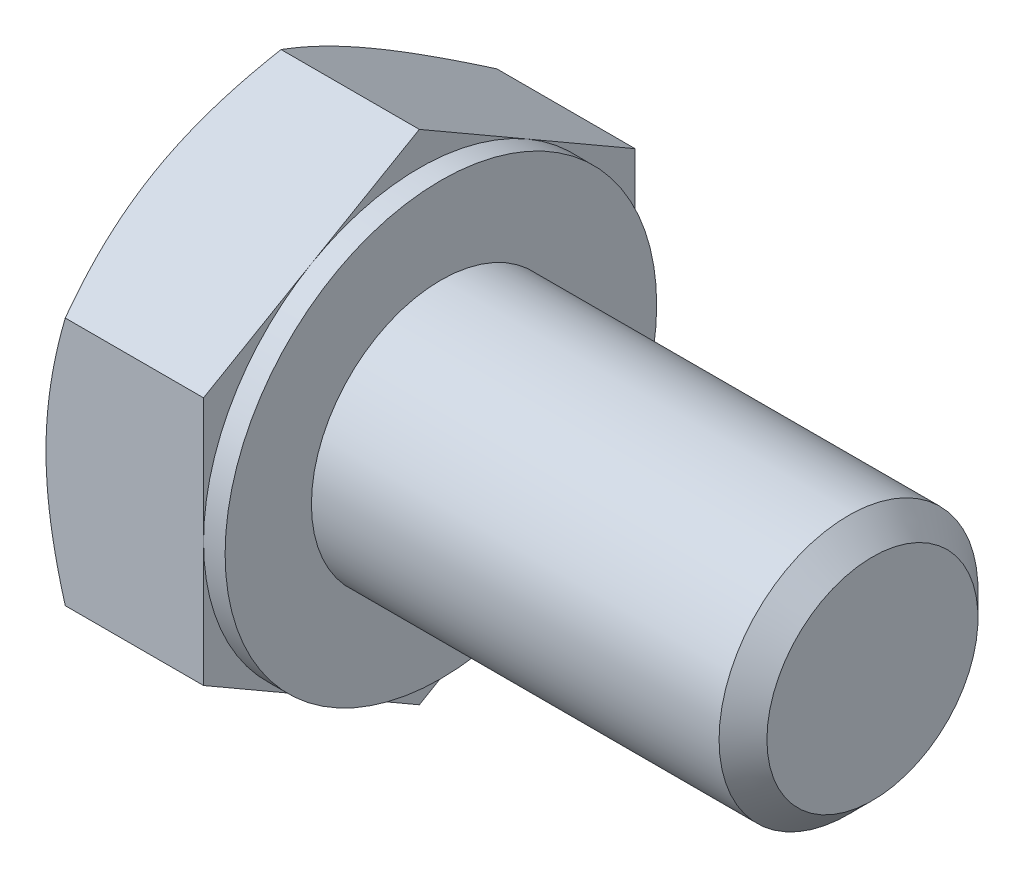
from build123d import *

# Parameters (mm, degrees)
BASEHEAD_DEPTH     = 4.15
INDENT_START       = -0.51875
INDENT_2_OUTLINE_R = 4.375
INDENT_2_DEPTH     = 0.51875
SKETCH4_W          = 0.5
SKETCH4_H          = 10.773502692


# Read off the part's stored shape, not the designer's step: Indent
with BuildPart() as part:
    # Sketch1 → BaseHead (new body)
    with BuildSketch(Plane(origin=(0, 0, 0), x_dir=(0, 0, -1), z_dir=(1, 0, 0))):
        Polygon((5, 2.886751346), (5, -2.886751346), (0, -5.773502692), (-5, -2.886751346), (-5, 2.886751346), (0, 5.773502692), align=None)
    extrude(amount=BASEHEAD_DEPTH)

    # Indent outline → Indent (revolve)
    with BuildSketch(Plane.YX):
        Polygon((3, 4.15), (3, 13.5955), (2.4455, 14.15), (0, 14.15), (0, 4.15), align=None)
    revolve(axis=Axis((0, 0, 0), (1, 0, 0)))

    # Indent 2 outline → Indent 2 (cut)
    with BuildSketch(Plane.ZY.offset(INDENT_START)):
        with Locations((0.033212245, 0.192376607)):
            Circle(INDENT_2_OUTLINE_R)
    extrude(amount=INDENT_2_DEPTH, mode=Mode.SUBTRACT)

    # Sketch3 → HeadChamfer (revolve, cut)
    with BuildSketch(Plane.XY, mode=Mode.PRIVATE) as headchamfer_sk:
        Polygon((0, 5), (3.333333333, 10.773502692), (3.333333333, 15.773502692), (-10, 15.773502692), (-10, 5), align=None)
    revolve(headchamfer_sk.sketch.rotate(Axis((0, 0, 0), (1, 0, 0)), 90), axis=Axis((0, 0, 0), (1, 0, 0)), mode=Mode.SUBTRACT)

    # Sketch4 → BearingFace (revolve, cut)
    with BuildSketch(Plane.XY, mode=Mode.PRIVATE) as bearingface_sk:
        with Locations((3.9, 10.386751346)):
            Rectangle(SKETCH4_W, SKETCH4_H)
    revolve(bearingface_sk.sketch.rotate(Axis((0, 0, 0), (1, 0, 0)), 90), axis=Axis((0, 0, 0), (1, 0, 0)), mode=Mode.SUBTRACT)


solid = part.part
